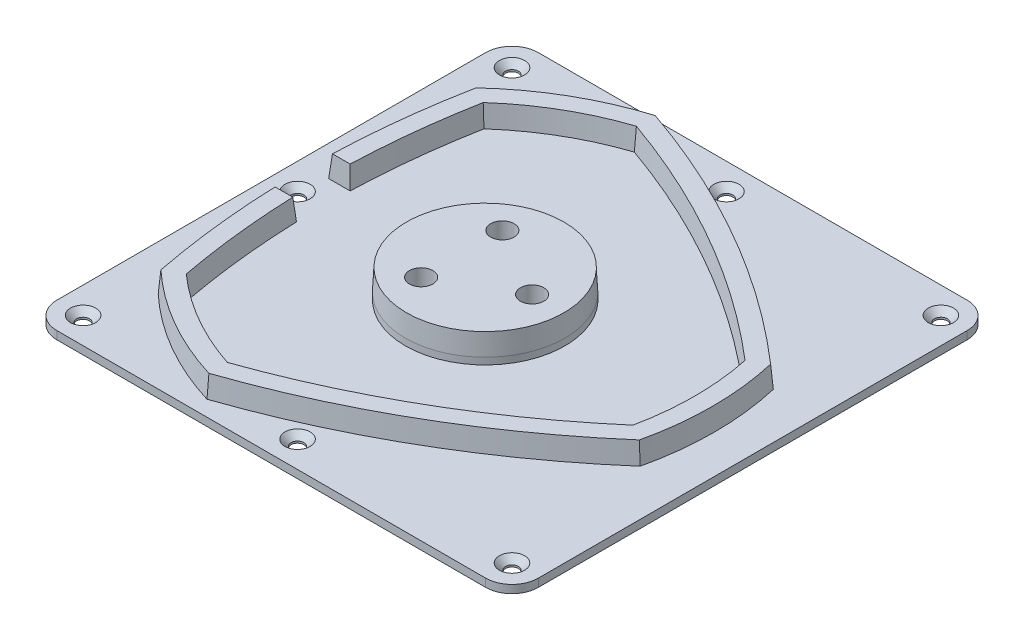
from build123d import *

# Parameters (mm, degrees)
SKETCH1_W                = 180
SKETCH1_H                = 180
SKETCH1_W_2              = 160
SKETCH1_H_2              = 160
SKETCH1_W_3              = 140
SKETCH1_H_3              = 140
BOSS_EXTRUDE1_DEPTH      = 3
SKETCH1_3_W              = 140
SKETCH1_3_H              = 140
BOSS_EXTRUDE2_DEPTH      = 5
SKETCH6_R                = 4.7
BOSS_EXTRUDE4_DEPTH      = 8
BOSS_EXTRUDE5_DEPTH      = 8
BOSS_EXTRUDE5_DRAFT      = 5
CUT_EXTRUDE1_START       = -5
SKETCH12_R               = 4.7
CUT_EXTRUDE1_DEPTH       = 5
SKETCH13_R               = 29.75
BOSS_EXTRUDE6_DEPTH      = 2.5
SKETCH14_R               = 29.75
SKETCH16_R               = 29.25
CUT_EXTRUDE2_START       = -2
CUT_EXTRUDE2_OUTLINE_R   = 34.25
CUT_EXTRUDE2_DEPTH       = 2
FILLET1_R                = 10
SKETCH19_W               = 140
SKETCH19_H               = 140
CUT_EXTRUDE3_DEPTH       = 5
F_5_16_CLEARANCE_HOLE1_D = 8.72998
SKETCH24_R               = 10
SKETCH24_R_2             = 4.36499
CUT_EXTRUDE4_DEPTH       = 7
CUT_EXTRUDE5_DEPTH       = 128.711589146


# Read off the part's stored shape, not the designer's step: CSK for M4 Flat Head Machine Screw1, Cut-Extrude2
with BuildPart() as part:
    # Sketch1 → Boss-Extrude1 (new body)
    # profile 1 of 3: a face of its own
    with BuildSketch(Plane(origin=(0, 0, 0), x_dir=(1, 0, 0), z_dir=(0, 1, 0))):
        Rectangle(SKETCH1_W, SKETCH1_H)
        Rectangle(SKETCH1_W_2, SKETCH1_H_2, mode=Mode.SUBTRACT)
    # profile 2 of 3: a face of its own
    with BuildSketch(Plane(origin=(0, 0, 0), x_dir=(1, 0, 0), z_dir=(0, 1, 0))):
        Rectangle(SKETCH1_W_2, SKETCH1_H_2)
        Rectangle(SKETCH1_W_3, SKETCH1_H_3, mode=Mode.SUBTRACT)
    # profile 3 of 3: a face of its own
    with BuildSketch(Plane(origin=(0, 0, 0), x_dir=(1, 0, 0), z_dir=(0, 1, 0))):
        Rectangle(SKETCH1_W_3, SKETCH1_H_3)
    extrude(amount=BOSS_EXTRUDE1_DEPTH)

    # Sketch1<3> → Boss-Extrude2 (add)
    with BuildSketch(Plane(origin=(0, 0, 0), x_dir=(1, 0, 0), z_dir=(0, 1, 0))):
        Rectangle(SKETCH1_3_W, SKETCH1_3_H)
    extrude(amount=-BOSS_EXTRUDE2_DEPTH)

    # CSK for M4 Flat Head Machine Screw1 outl → CSK for M4 Flat Head Machine Screw1 (revolve, cut)
    with BuildSketch(Plane(origin=(-80, 0, 0), x_dir=(1, 0, 0), z_dir=(0, 0, 1))):
        Polygon((0, 0), (2.4, 0), (2.4, 0.7), (4.7, 3), (0, 3), align=None)
    revolve(axis=Axis((-80, 0, 0), (0, 1, 0)), mode=Mode.SUBTRACT)

    # CSK for M4 Flat Head Machine Screw1 2 ou → CSK for M4 Flat Head Machine Screw1 2 (revolve, cut)
    with BuildSketch(Plane.XY.offset(80)):
        Polygon((0, 0), (2.4, 0), (2.4, 0.7), (4.7, 3), (0, 3), align=None)
    revolve(axis=Axis((0, 0, 80), (0, 1, 0)), mode=Mode.SUBTRACT)

    # CSK for M4 Flat Head Machine Screw1 3 ou → CSK for M4 Flat Head Machine Screw1 3 (revolve, cut)
    with BuildSketch(Plane(origin=(80, 0, 0), x_dir=(1, 0, 0), z_dir=(0, 0, 1))):
        Polygon((0, 0), (2.4, 0), (2.4, 0.7), (4.7, 3), (0, 3), align=None)
    revolve(axis=Axis((80, 0, 0), (0, 1, 0)), mode=Mode.SUBTRACT)

    # CSK for M4 Flat Head Machine Screw1 4 ou → CSK for M4 Flat Head Machine Screw1 4 (revolve, cut)
    with BuildSketch(Plane.XY.offset(-80)):
        Polygon((0, 0), (2.4, 0), (2.4, 0.7), (4.7, 3), (0, 3), align=None)
    revolve(axis=Axis((0, 0, -80), (0, 1, 0)), mode=Mode.SUBTRACT)

    # CSK for M4 Flat Head Machine Screw1 5 ou → CSK for M4 Flat Head Machine Screw1 5 (revolve, cut)
    with BuildSketch(Plane(origin=(-80, 0, 80), x_dir=(1, 0, 0), z_dir=(0, 0, 1))):
        Polygon((0, 0), (2.4, 0), (2.4, 0.7), (4.7, 3), (0, 3), align=None)
    revolve(axis=Axis((-80, 0, 80), (0, 1, 0)), mode=Mode.SUBTRACT)

    # CSK for M4 Flat Head Machine Screw1 6 ou → CSK for M4 Flat Head Machine Screw1 6 (revolve, cut)
    with BuildSketch(Plane(origin=(80, 0, -80), x_dir=(1, 0, 0), z_dir=(0, 0, 1))):
        Polygon((0, 0), (2.4, 0), (2.4, 0.7), (4.7, 3), (0, 3), align=None)
    revolve(axis=Axis((80, 0, -80), (0, 1, 0)), mode=Mode.SUBTRACT)

    # CSK for M4 Flat Head Machine Screw1 7 ou → CSK for M4 Flat Head Machine Screw1 7 (revolve, cut)
    with BuildSketch(Plane(origin=(80, 0, 80), x_dir=(1, 0, 0), z_dir=(0, 0, 1))):
        Polygon((0, 0), (2.4, 0), (2.4, 0.7), (4.7, 3), (0, 3), align=None)
    revolve(axis=Axis((80, 0, 80), (0, 1, 0)), mode=Mode.SUBTRACT)

    # CSK for M4 Flat Head Machine Screw1 8 ou → CSK for M4 Flat Head Machine Screw1 8 (revolve, cut)
    with BuildSketch(Plane(origin=(-80, 0, -80), x_dir=(1, 0, 0), z_dir=(0, 0, 1))):
        Polygon((0, 0), (2.4, 0), (2.4, 0.7), (4.7, 3), (0, 3), align=None)
    revolve(axis=Axis((-80, 0, -80), (0, 1, 0)), mode=Mode.SUBTRACT)

    # CSK for M4 Flat Head Machine Screw1 9 ou → CSK for M4 Flat Head Machine Screw1 9 (revolve, cut)
    with BuildSketch(Plane.XY):
        Polygon((0, -5), (2.4, -5), (2.4, 0.7), (4.7, 3), (0, 3), align=None)
    revolve(axis=Axis((0, 0, 0), (0, 1, 0)), mode=Mode.SUBTRACT)

    # Sketch6 → Boss-Extrude4 (add, through all)
    with BuildSketch(Plane(origin=(0, 3, 0), x_dir=(1, 0, 0), z_dir=(0, 1, 0))):
        with Locations(Location((80, 0, 0), (0, 0, 270))):
            Circle(SKETCH6_R)
        Circle(SKETCH6_R)
    extrude(amount=-BOSS_EXTRUDE4_DEPTH)


with BuildPart() as boss_extrude5_tool:
    # Sketch10 → Boss-Extrude5 (with draft: the straight prism first)
    with BuildSketch(Plane(origin=(0, 3, 0), x_dir=(1, 0, 0), z_dir=(0, 1, 0))):
        with BuildLine():
            Line((-70.393178849, -10), (-78.397496431, -10))
            ThreePointArc((-78.397496431, -10), (-76.604236916, -34.68045004), (-72.838821124, -59.137801445))
            ThreePointArc((-72.838821124, -59.137801445), (-52.739092363, -74.026279442), (-29.795427813, -83.98891616))
            ThreePointArc((-29.795427813, -83.98891616), (24.279800219, -59.374355653), (72.634248938, -24.851114715))
            ThreePointArc((72.634248938, -24.851114715), (75.478184725, 0), (72.634248938, 24.851114715))
            ThreePointArc((72.634248938, 24.851114715), (24.279800219, 59.374355653), (-29.795427813, 83.98891616))
            ThreePointArc((-29.795427813, 83.98891616), (-52.739092363, 74.026279442), (-72.838821124, 59.137801445))
            ThreePointArc((-72.838821124, 59.137801445), (-76.604236916, 34.68045004), (-78.397496431, 10))
            Line((-78.397496431, 10), (-70.393178849, 10))
            ThreePointArc((-70.393178849, 10), (-68.785863401, 32.603044383), (-65.480018889, 55.020726474))
            ThreePointArc((-65.480018889, 55.020726474), (-48.739092363, 67.098076211), (-29.909337417, 75.557468997))
            ThreePointArc((-29.909337417, 75.557468997), (20.279800219, 52.446152423), (65.389356306, 20.536742523))
            ThreePointArc((65.389356306, 20.536742523), (67.478184725, 0), (65.389356306, -20.536742523))
            ThreePointArc((65.389356306, -20.536742523), (20.279800219, -52.446152423), (-29.909337417, -75.557468997))
            ThreePointArc((-29.909337417, -75.557468997), (-48.739092363, -67.098076211), (-65.480018889, -55.020726474))
            ThreePointArc((-65.480018889, -55.020726474), (-68.785863401, -32.603044383), (-70.393178849, -10))
        make_face()
    extrude(amount=BOSS_EXTRUDE5_DEPTH)
    # Boss-Extrude5: the draft: its side faces are tilted about the plane it starts from
    boss_extrude5_sides = [boss_extrude5_tool.faces().sort_by_distance(p)[0] for p in [
        (-74.39533764, 7, 10),
        (-76.604236916, 7, 34.68045004),
        (-52.739092363, 7, 74.026279442),
        (24.279800219, 7, 59.374355653),
        (75.478184725, 7, 0),
        (24.279800219, 7, -59.374355653),
        (-52.739092363, 7, -74.026279442),
        (-76.604236916, 7, -34.68045004),
        (-74.39533764, 7, -10),
        (-68.785863401, 7, -32.603044383),
        (-48.739092363, 7, -67.098076211),
        (20.279800219, 7, -52.446152423),
        (67.478184725, 7, 0),
        (20.279800219, 7, 52.446152423),
        (-48.739092363, 7, 67.098076211),
        (-68.785863401, 7, 32.603044383),
    ]]
    draft(boss_extrude5_sides, Plane(origin=(0, 3, 0), x_dir=(1, 0, 0), z_dir=(0, 1, 0)), BOSS_EXTRUDE5_DRAFT)


with BuildPart() as part_1:
    add(part.part)

    # Boss-Extrude5: add boss_extrude5_tool
    add(boss_extrude5_tool.part)

    # Sketch12 → Cut-Extrude1 (cut)
    with BuildSketch(Plane.XZ.offset(5).offset(CUT_EXTRUDE1_START)):
        with Locations((80, 0)):
            Circle(SKETCH12_R)
    extrude(amount=CUT_EXTRUDE1_DEPTH, mode=Mode.SUBTRACT)

    # Sketch13 → Boss-Extrude6 (add)
    with BuildSketch(Plane(origin=(0, 3, 0), x_dir=(1, 0, 0), z_dir=(0, 1, 0))):
        with Locations(Location((-10, 0, 0), (0, 0, 270))):
            Circle(SKETCH13_R)
    extrude(amount=BOSS_EXTRUDE6_DEPTH)

    # Sketch14 → Loft1 section 0
    with BuildSketch(Plane(origin=(0, 5.5, 0), x_dir=(1, 0, 0), z_dir=(0, 1, 0))):
        with Locations((-10, 0)):
            Circle(SKETCH14_R)
    # Sketch16 → Loft1 section 1
    with BuildSketch(Plane(origin=(0, 15.5, 0), x_dir=(1, 0, 0), z_dir=(0, 1, 0))):
        with Locations((-10, 0)):
            Circle(SKETCH16_R)
    loft()

    # Cut-Extrude2 outline → Cut-Extrude2 (cut)
    with BuildSketch(Plane(origin=(0, 15.5, 0), x_dir=(1, 0, 0), z_dir=(0, 1, 0)).offset(CUT_EXTRUDE2_START)):
        with Locations((-10, 0)):
            Circle(CUT_EXTRUDE2_OUTLINE_R)
    extrude(amount=CUT_EXTRUDE2_DEPTH, mode=Mode.SUBTRACT)

    # Fillet1
    fillet1_edges = [part_1.edges().sort_by_distance(p)[0] for p in [
        (-90, 1.5, 90),
        (-90, 1.5, -90),
        (90, 1.5, -90),
        (90, 1.5, 90),
    ]]
    fillet(fillet1_edges, radius=FILLET1_R)

    # Sketch19 → Cut-Extrude3 (cut)
    with BuildSketch(Plane.XZ.offset(5)):
        Rectangle(SKETCH19_W, SKETCH19_H)
    extrude(amount=-CUT_EXTRUDE3_DEPTH, mode=Mode.SUBTRACT)

    # 5/16 Clearance Hole1 (through all)
    with Locations(Plane(origin=(0, 13.5, 0), x_dir=(1, 0, 0), z_dir=(0, 1, 0))):
        with Locations((-18.75, 15.155444566), (7.5, 0), (-18.75, -15.155444566)):
            Hole(F_5_16_CLEARANCE_HOLE1_D / 2)

    # Sketch24 → Cut-Extrude4 (cut)
    # profile 1 of 6: a face of its own
    with BuildSketch(Plane.XZ):
        with Locations(Location((-18.75, 15.155444566, 0), (0, 0, 270))):
            Circle(SKETCH24_R)
        with Locations(Location((-18.75, 15.155444566, 0), (0, 0, 90))):
            Circle(SKETCH24_R_2, mode=Mode.SUBTRACT)
    # profile 2 of 6: a face of its own
    with BuildSketch(Plane.XZ):
        with Locations(Location((7.5, 0, 0), (0, 0, 270))):
            Circle(SKETCH24_R)
        with Locations(Location((7.5, 0, 0), (0, 0, 90))):
            Circle(SKETCH24_R_2, mode=Mode.SUBTRACT)
    # profile 3 of 6: a face of its own
    with BuildSketch(Plane.XZ):
        with Locations(Location((-18.75, -15.155444566, 0), (0, 0, 270))):
            Circle(SKETCH24_R)
        with Locations(Location((-18.75, -15.155444566, 0), (0, 0, 90))):
            Circle(SKETCH24_R_2, mode=Mode.SUBTRACT)
    # profile 4 of 6: a face of its own
    with BuildSketch(Plane.XZ):
        with Locations(Location((-18.75, -15.155444566, 0), (0, 0, 90))):
            Circle(SKETCH24_R_2)
    # profile 5 of 6: a face of its own
    with BuildSketch(Plane.XZ):
        with Locations(Location((-18.75, 15.155444566, 0), (0, 0, 90))):
            Circle(SKETCH24_R_2)
    # profile 6 of 6: a face of its own
    with BuildSketch(Plane.XZ):
        with Locations(Location((7.5, 0, 0), (0, 0, 90))):
            Circle(SKETCH24_R_2)
    extrude(amount=-CUT_EXTRUDE4_DEPTH, mode=Mode.SUBTRACT)

    # Sketch25 → Cut-Extrude5 (cut, through all)
    with BuildSketch(Plane(origin=(0, 3, 0), x_dir=(1, 0, 0), z_dir=(0, 1, 0))):
        with BuildLine():
            Line((90, -80), (90, 80))
            ThreePointArc((90, 80), (87.071067812, 87.071067812), (80, 90))
            Line((80, 90), (-80, 90))
            ThreePointArc((-80, 90), (-87.071067812, 87.071067812), (-90, 80))
            Line((-90, 80), (-90, -80))
            ThreePointArc((-90, -80), (-87.071067812, -87.071067812), (-80, -90))
            Line((-80, -90), (80, -90))
            ThreePointArc((80, -90), (87.071067812, -87.071067812), (90, -80))
        make_face()
        with BuildLine():
            Line((-80, 89.8), (80, 89.8))
            ThreePointArc((80, 89.8), (86.929646456, 86.929646456), (89.8, 80))
            Line((89.8, 80), (89.8, -80))
            ThreePointArc((89.8, -80), (86.929646456, -86.929646456), (80, -89.8))
            Line((80, -89.8), (-80, -89.8))
            ThreePointArc((-80, -89.8), (-86.929646456, -86.929646456), (-89.8, -80))
            Line((-89.8, -80), (-89.8, 80))
            ThreePointArc((-89.8, 80), (-86.929646456, 86.929646456), (-80, 89.8))
        make_face(mode=Mode.SUBTRACT)
    extrude(amount=-CUT_EXTRUDE5_DEPTH, mode=Mode.SUBTRACT)


solid = part_1.part
